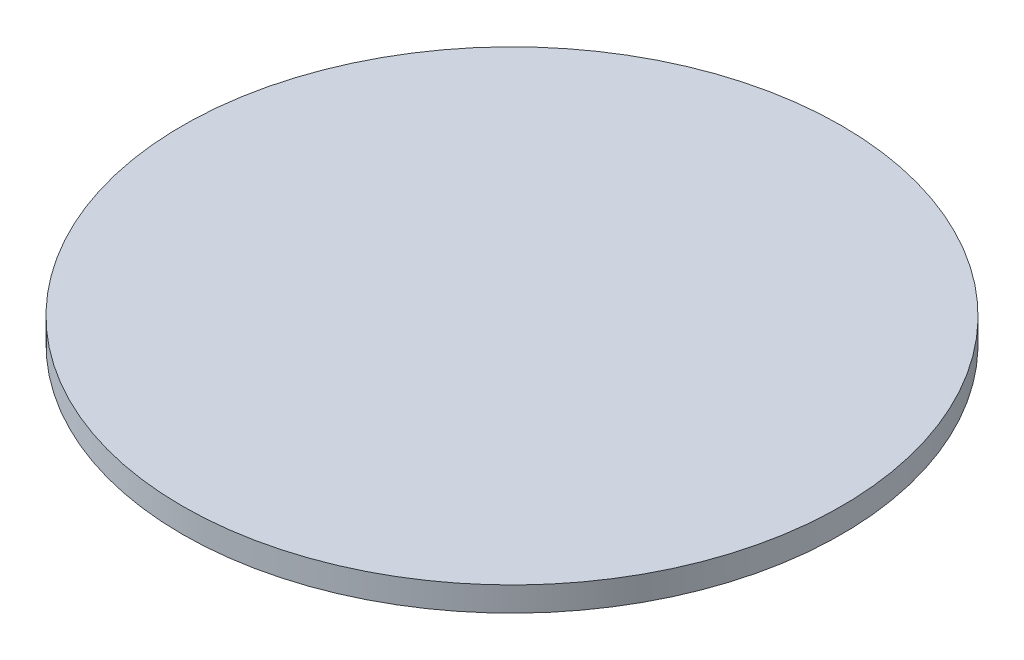
from build123d import *

# Parameters (mm, degrees)
SKETCH1_R           = 34.260924826
BOSS_EXTRUDE1_DEPTH = 2.54


with BuildPart() as part:
    # Sketch1 → Boss-Extrude1 (new body)
    with BuildSketch(Plane(origin=(0, 0, 0), x_dir=(1, 0, 0), z_dir=(0, 1, 0))):
        Circle(SKETCH1_R)
    extrude(amount=BOSS_EXTRUDE1_DEPTH)


solid = part.part
